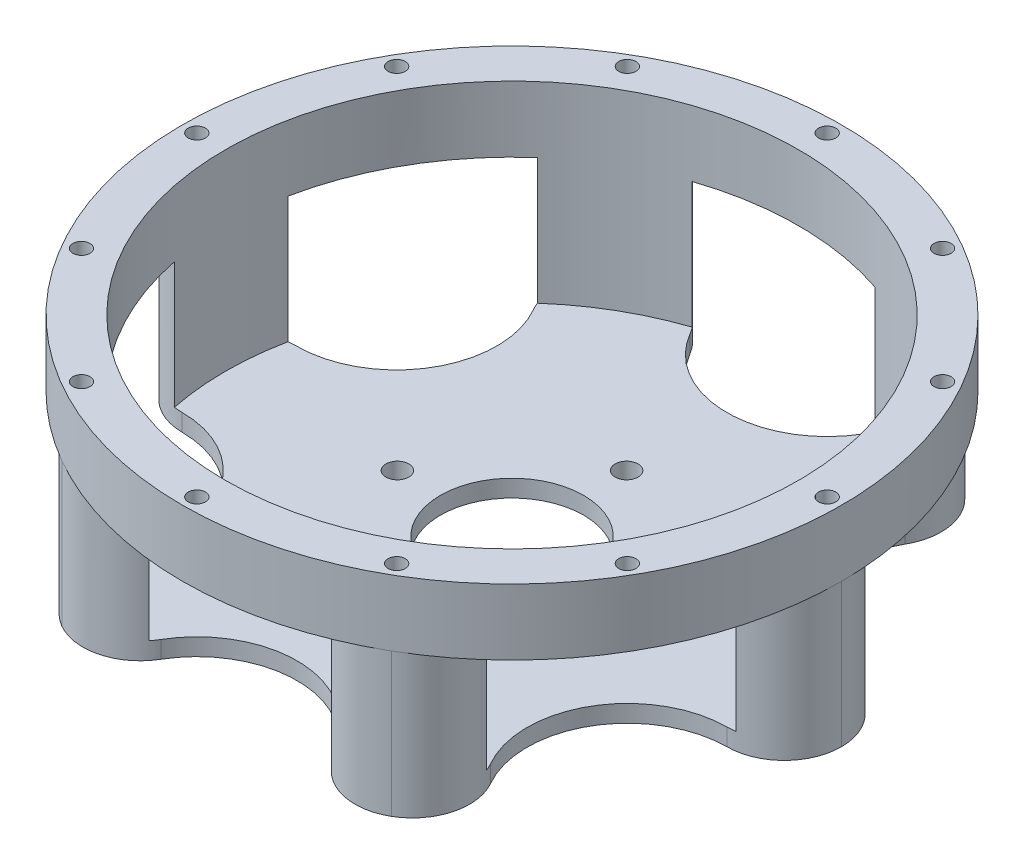
from build123d import *

# Parameters (mm, degrees)
SKETCH1_R             = 57.5
SKETCH1_R_2           = 1.5
BOSS_EXTRUDE1_DEPTH   = 36.5
SKETCH2_R             = 50
CUT_EXTRUDE1_DEPTH    = 33.5
SKETCH3_R             = 17.5
CUT_EXTRUDE2_DEPTH    = 25
FILLET1_R             = 10
CIRPATTERN2_OUTLINE_R = 1.5
CIRPATTERN2_DEPTH     = 25
SKETCH5_R             = 2
SKETCH5_R_2           = 12.5
CUT_EXTRUDE3_DEPTH    = 25


# Read off the part's stored shape, not the designer's step: CirPattern2
with BuildPart() as part:
    # Sketch1 → Boss-Extrude1 (new body)
    with BuildSketch(Plane(origin=(0, 0, 0), x_dir=(1, 0, 0), z_dir=(0, 1, 0))):
        with Locations(Location((0, 0, 0), (0, 0, 270))):
            Circle(SKETCH1_R)
        with Locations(Location((55, 0, 0), (0, 0, 270))):
            Circle(SKETCH1_R_2, mode=Mode.SUBTRACT)
        with Locations(Location((47.631397208, -27.5, 0), (0, 0, 270))):
            Circle(SKETCH1_R_2, mode=Mode.SUBTRACT)
        with Locations(Location((27.5, -47.631397208, 0), (0, 0, 270))):
            Circle(SKETCH1_R_2, mode=Mode.SUBTRACT)
        with Locations(Location((0, -55, 0), (0, 0, 270))):
            Circle(SKETCH1_R_2, mode=Mode.SUBTRACT)
        with Locations(Location((-27.5, -47.631397208, 0), (0, 0, 270))):
            Circle(SKETCH1_R_2, mode=Mode.SUBTRACT)
        with Locations(Location((-47.631397208, -27.5, 0), (0, 0, 270))):
            Circle(SKETCH1_R_2, mode=Mode.SUBTRACT)
        with Locations(Location((-55, 0, 0), (0, 0, 270))):
            Circle(SKETCH1_R_2, mode=Mode.SUBTRACT)
        with Locations(Location((-47.631397208, 27.5, 0), (0, 0, 270))):
            Circle(SKETCH1_R_2, mode=Mode.SUBTRACT)
        with Locations(Location((-27.5, 47.631397208, 0), (0, 0, 270))):
            Circle(SKETCH1_R_2, mode=Mode.SUBTRACT)
        with Locations(Location((0, 55, 0), (0, 0, 270))):
            Circle(SKETCH1_R_2, mode=Mode.SUBTRACT)
        with Locations(Location((27.5, 47.631397208, 0), (0, 0, 270))):
            Circle(SKETCH1_R_2, mode=Mode.SUBTRACT)
        with Locations(Location((47.631397208, 27.5, 0), (0, 0, 270))):
            Circle(SKETCH1_R_2, mode=Mode.SUBTRACT)
    extrude(amount=BOSS_EXTRUDE1_DEPTH)

    # Sketch2 → Cut-Extrude1 (cut)
    with BuildSketch(Plane(origin=(0, 36.5, 0), x_dir=(1, 0, 0), z_dir=(0, 1, 0))):
        with Locations(Location((0, 0, 0), (0, 0, 270))):
            Circle(SKETCH2_R)
    extrude(amount=-CUT_EXTRUDE1_DEPTH, mode=Mode.SUBTRACT)

    # Sketch3 → Cut-Extrude2 (cut)
    with BuildSketch(Plane.XZ):
        with Locations((0, 55)):
            Circle(SKETCH3_R)
    extrude(amount=-CUT_EXTRUDE2_DEPTH, mode=Mode.SUBTRACT)

    # Fillet1
    # the kernel refuses this fillet: 10 mm, written as the material it takes off along each edge
    with BuildSketch(Plane(origin=(-17.498524141, 25, 54.772727273), x_dir=(-0.9145471310775286, 0, -0.4044793505704111), z_dir=(0, -1, 0))) as fillet1_piece_1:
        with BuildLine():
            CenterArc((11.232648192, 9.942614308), FILLET1_R, 186.415260194, 89.725856468)
            ThreePointArc((1.29526624, 8.825278217), (1.219357444, 4.328728415), (0, 0))
            ThreePointArc((0, 0), (6.151212105, -0.329967731), (12.30242421, 0))
        make_face()
    extrude(amount=55.756060526, mode=Mode.SUBTRACT)
    with BuildSketch(Plane(origin=(17.498524141, 25, 54.772727273), x_dir=(0.9145471310775289, 0, -0.4044793505704104), z_dir=(0, -1, 0))) as fillet1_piece_2:
        with BuildLine():
            CenterArc((11.232648192, -9.942614308), FILLET1_R, 83.858883338, 89.725856468)
            ThreePointArc((1.29526624, -8.825278217), (1.219357444, -4.328728415), (0, 0))
            ThreePointArc((0, 0), (6.151212105, 0.329967731), (12.30242421, 0))
        make_face()
    extrude(amount=55.756060526, mode=Mode.SUBTRACT)

    # CirPattern2 outline → CirPattern2 (cut)
    # profile 1 of 5: a face of its own
    with BuildSketch(Plane(origin=(0, 0, 0), x_dir=(1, 0, 0), z_dir=(0, 1, 0))):
        with BuildLine():
            ThreePointArc((-32.43431744, -36.177486186), (-32.475952642, -18.75), (-47.547780802, -10.000199764))
            ThreePointArc((-47.547780802, -10.000199764), (-54.587917435, -7.054491856), (-57.499999999, -0.000380002))
            ThreePointArc((-57.499999999, -0.000380002), (-49.796460718, -28.75), (-28.750329091, -49.796270715))
            ThreePointArc((-28.750329091, -49.796270715), (-33.403327875, -43.747277311), (-32.43431744, -36.177486186))
        make_face()
        with Locations((-47.631397208, -27.5)):
            Circle(CIRPATTERN2_OUTLINE_R, mode=Mode.SUBTRACT)
    # profile 2 of 5: a face of its own
    with BuildSketch(Plane(origin=(0, 0, 0), x_dir=(1, 0, 0), z_dir=(0, 1, 0))):
        with BuildLine():
            ThreePointArc((-32.43431744, 36.177486186), (-33.403327875, 43.747277311), (-28.750329091, 49.796270715))
            ThreePointArc((-28.750329091, 49.796270715), (-49.796460718, 28.75), (-57.499999999, 0.000380002))
            ThreePointArc((-57.499999999, 0.000380002), (-54.587917435, 7.054491856), (-47.547780802, 10.000199764))
            ThreePointArc((-47.547780802, 10.000199764), (-32.475952642, 18.75), (-32.43431744, 36.177486186))
        make_face()
        with Locations((-47.631397208, 27.5)):
            Circle(CIRPATTERN2_OUTLINE_R, mode=Mode.SUBTRACT)
    # profile 3 of 5: a face of its own
    with BuildSketch(Plane(origin=(0, 0, 0), x_dir=(1, 0, 0), z_dir=(0, 1, 0))):
        with BuildLine():
            ThreePointArc((57.499999999, -0.000380002), (54.587917435, -7.054491856), (47.547780802, -10.000199764))
            ThreePointArc((47.547780802, -10.000199764), (32.475952642, -18.75), (32.43431744, -36.177486186))
            ThreePointArc((32.43431744, -36.177486186), (33.403327875, -43.747277311), (28.750329091, -49.796270715))
            ThreePointArc((28.750329091, -49.796270715), (49.796460718, -28.75), (57.499999999, -0.000380002))
        make_face()
        with Locations((47.631397208, -27.5)):
            Circle(CIRPATTERN2_OUTLINE_R, mode=Mode.SUBTRACT)
    # profile 4 of 5: a face of its own
    with BuildSketch(Plane(origin=(0, 0, 0), x_dir=(1, 0, 0), z_dir=(0, 1, 0))):
        with BuildLine():
            ThreePointArc((15.113463363, 46.17768595), (21.18458956, 50.801769166), (28.749670908, 49.796650718))
            ThreePointArc((28.749670908, 49.796650718), (0, 57.5), (-28.749670908, 49.796650718))
            ThreePointArc((-28.749670908, 49.796650718), (-21.18458956, 50.801769166), (-15.113463363, 46.17768595))
            ThreePointArc((-15.113463363, 46.17768595), (0, 37.5), (15.113463363, 46.17768595))
        make_face()
        with Locations((0, 55)):
            Circle(CIRPATTERN2_OUTLINE_R, mode=Mode.SUBTRACT)
    # profile 5 of 5: a face of its own
    with BuildSketch(Plane(origin=(0, 0, 0), x_dir=(1, 0, 0), z_dir=(0, 1, 0))):
        with BuildLine():
            ThreePointArc((28.750329091, 49.796270715), (33.403327875, 43.747277311), (32.43431744, 36.177486186))
            ThreePointArc((32.43431744, 36.177486186), (32.475952642, 18.75), (47.547780802, 10.000199764))
            ThreePointArc((47.547780802, 10.000199764), (54.587917435, 7.054491856), (57.499999999, 0.000380002))
            ThreePointArc((57.499999999, 0.000380002), (49.796460718, 28.75), (28.750329091, 49.796270715))
        make_face()
        with Locations((47.631397208, 27.5)):
            Circle(CIRPATTERN2_OUTLINE_R, mode=Mode.SUBTRACT)
    extrude(amount=CIRPATTERN2_DEPTH, mode=Mode.SUBTRACT)

    # Sketch5 → Cut-Extrude3 (cut)
    with BuildSketch(Plane.XZ):
        with Locations(Location((0, 20, 0), (0, 0, 270))):
            Circle(SKETCH5_R)
        with Locations(Location((20, 0, 0), (0, 0, 270))):
            Circle(SKETCH5_R)
        with Locations(Location((0, -20, 0), (0, 0, 270))):
            Circle(SKETCH5_R)
        with Locations(Location((-20, 0, 0), (0, 0, 270))):
            Circle(SKETCH5_R)
        with Locations(Location((0, 0, 0), (0, 0, 270))):
            Circle(SKETCH5_R_2)
    extrude(amount=-CUT_EXTRUDE3_DEPTH, mode=Mode.SUBTRACT)


solid = part.part
